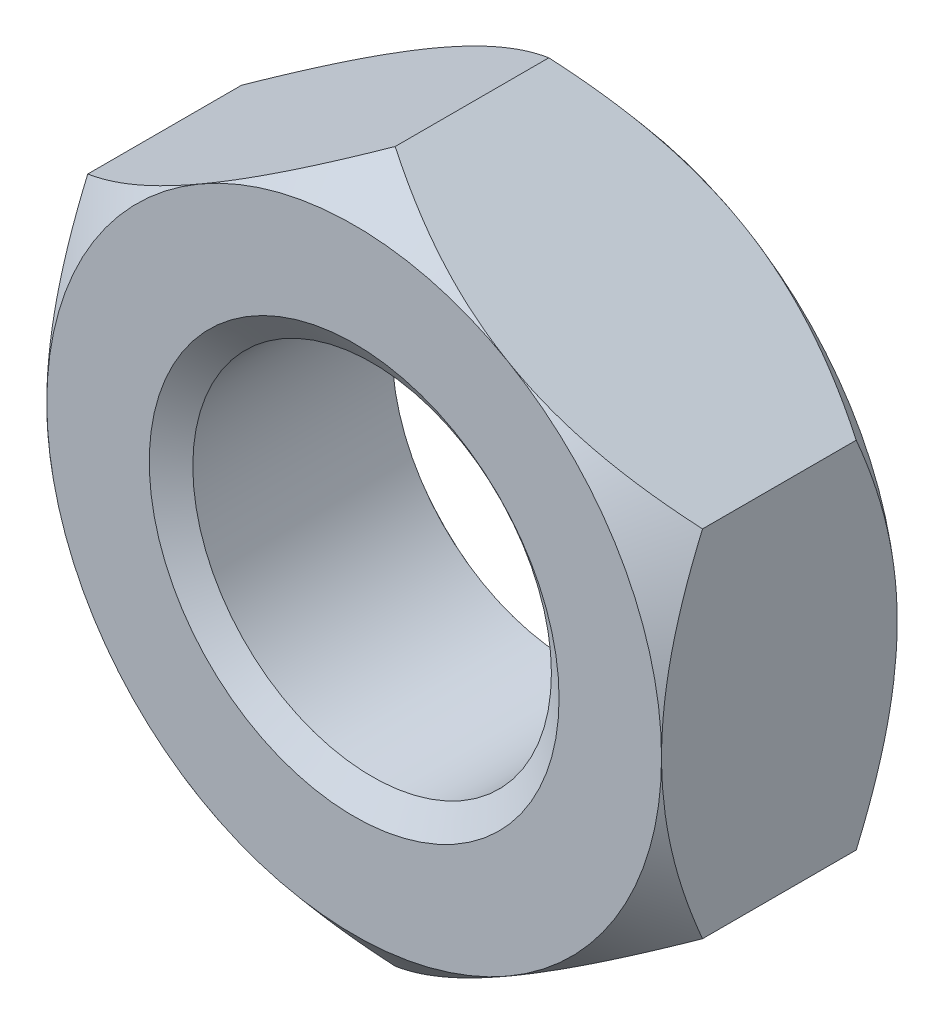
from build123d import *

# Parameters (mm, degrees)
BASENUTSKE_R  = 11.1125
BASENUT_DEPTH = 14.605


with BuildPart() as part:
    # BaseNutSke → BaseNut (new body)
    with BuildSketch(Plane.XY):
        Polygon((19.05, 10.998522628), (19.05, -10.998522628), (0, -21.997045256), (-19.05, -10.998522628), (-19.05, 10.998522628), (0, 21.997045256), align=None)
        Circle(BASENUTSKE_R, mode=Mode.SUBTRACT)
    extrude(amount=-BASENUT_DEPTH)

    # Sketch3 → Double-Chamfer (revolve, cut)
    with BuildSketch(Plane(origin=(0, 0, 0), x_dir=(0, 0, -1), z_dir=(1, 0, 0))):
        Polygon((14.605, 19.05), (12.065, 21.997045256), (12.065, 34.697045256), (27.305, 34.697045256), (27.305, 19.05), align=None)
        Polygon((2.54, 34.697045256), (-12.7, 34.697045256), (-12.7, 19.05), (0, 19.05), (2.54, 21.997045256), align=None)
    revolve(axis=Axis((0, 0, 0), (0, 0, -1)), mode=Mode.SUBTRACT)

    # EndChamferSke → EndChamfer (revolve, cut)
    with BuildSketch(Plane(origin=(0, 0, 0), x_dir=(0, 0, -1), z_dir=(1, 0, 0))):
        Polygon((14.5796, 12.7), (13.356862586, 10.95375), (14.6304, 10.95375), (14.6304, 12.7), align=None)
        Polygon((-0.0508, 12.7), (0, 12.7), (1.222737414, 10.95375), (-0.0508, 10.95375), align=None)
    revolve(axis=Axis((0, 0, -25.037505729), (0, 0, -1)), mode=Mode.SUBTRACT)


solid = part.part
